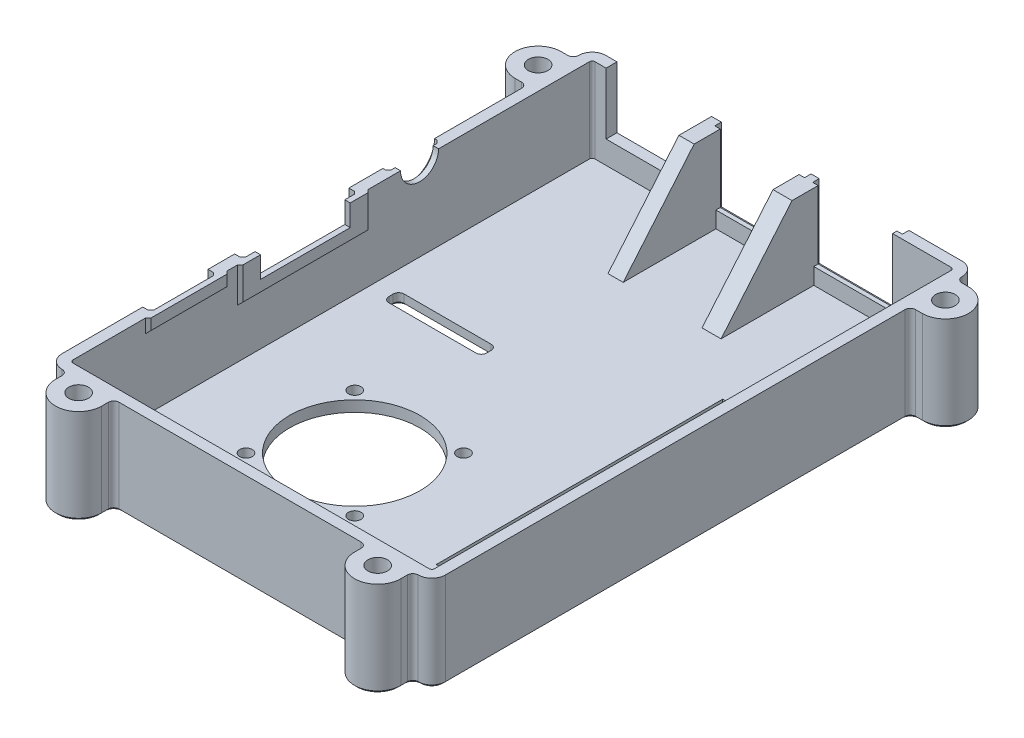
from build123d import *

# Parameters (mm, degrees)
BASE_DEPTH                      = 17.5
SHELL_T                         = -2
CLAMPS_DEPTH                    = 17.5
CLAMP_FILLETS_R                 = 1
SKETCH20_R                      = 1.8
CLAMP_HOLES_DEPTH               = 128.387411073
SKETCH21_R                      = 2.9
CLAMP_COUNTERSINKS_DEPTH        = 3.4
CLAMP_COUNTERSINK_CHAMFERS_SIZE = 0.3
SKETCH24_W                      = 14.5
SKETCH24_H                      = 12.5
USB_CUTOUT_DEPTH                = 18.25
SKETCH25_W                      = 16.5
SKETCH25_H                      = 13.5
USB_APPROACH_DEPTH              = 1.2
USB_INNER_SUPPORT_DEPTH         = 3.5
USB_OUTER_SUPPORT_DEPTH         = 2.8
SKETCH28_W                      = 17.4
SKETCH28_H                      = 11.3
RJ45_CUTOUT_DEPTH               = 22.7
SKETCH29_W                      = 15
SKETCH29_H                      = 2.5
SKETCH29_W_2                    = 24
SKETCH29_H_2                    = 6.43
HDMI_SUPPORT_DEPTH              = 0.5
HDMI_SUPPORT_CHAMFER_SIZE       = 0.5
SKETCH30_W                      = 21
SKETCH30_H                      = 5.93
SKETCH30_W_2                    = 12
SKETCH30_H_2                    = 2
HDMI_APPROACH_DEPTH             = 1.5
SKETCH31_W                      = 16.5
SKETCH31_H                      = 3.93
HDMI_CUTOUT_DEPTH               = 1
HDMI_APPROACH_CHAMFER_SIZE      = 0.5
SKETCH32_R                      = 3.5
AUDIO_CUTOUT_DEPTH              = 2
SKETCH33_R                      = 4.75
AUDIO_APPROACH_DEPTH            = 1
AUDIO_APPROACH_CHAMFER_SIZE     = 0.5
SKETCH34_W                      = 6
SKETCH34_H                      = 52.7
HEADER_CUTOUT_DEPTH             = 2
HEADER_COVER_DEPTH              = 1
SHELL_CHAMFER_SIZE              = 0.5
RIBBON_SLOT_DEPTH               = 2
RIBBON_SLOT_CHAMFER_SIZE        = 0.5
SKETCH39_R                      = 12
SKETCH39_R_2                    = 1.15
FAN_MOUNT_DEPTH                 = 2


with BuildPart() as part:
    # Sketch2 → Base (new body)
    with BuildSketch(Plane(origin=(0, 0, 0), x_dir=(1, 0, 0), z_dir=(0, 1, 0))):
        with BuildLine():
            Line((2.5, 0), (68, 0))
            ThreePointArc((68, 0), (69.767766953, 0.732233047), (70.5, 2.5))
            Line((70.5, 2.5), (70.5, 97.5))
            ThreePointArc((70.5, 97.5), (69.767766953, 99.267766953), (68, 100))
            Line((68, 100), (2.5, 100))
            ThreePointArc((2.5, 100), (0.732233047, 99.267766953), (0, 97.5))
            Line((0, 97.5), (0, 2.5))
            ThreePointArc((0, 2.5), (0.732233047, 0.732233047), (2.5, 0))
        make_face()
    extrude(amount=BASE_DEPTH)

    # Shell
    shell_openings = [part.faces().sort_by_distance(p)[0] for p in [
        (35.25, 17.5, -50),
    ]]
    offset(amount=SHELL_T, openings=shell_openings, kind=Kind.INTERSECTION)

    # Sketch14 → Clamps (add)
    with BuildSketch(Plane.XZ):
        with BuildLine():
            Line((-2.2, -88), (0, -88))
            Line((0, -88), (0, -96.5))
            Line((0, -96.5), (-2.2, -96.5))
            ThreePointArc((-2.2, -96.5), (-6.45, -92.25), (-2.2, -88))
        make_face()
        with BuildLine():
            Line((3.5, 2.2), (3.5, 0))
            Line((3.5, 0), (12, 0))
            Line((12, 0), (12, 2.2))
            ThreePointArc((12, 2.2), (7.75, 6.45), (3.5, 2.2))
        make_face()
        with BuildLine():
            Line((72.7, -88), (70.5, -88))
            Line((70.5, -88), (70.5, -96.5))
            Line((70.5, -96.5), (72.7, -96.5))
            ThreePointArc((72.7, -96.5), (76.95, -92.25), (72.7, -88))
        make_face()
        with BuildLine():
            Line((58.5, 0), (58.5, 2.2))
            ThreePointArc((58.5, 2.2), (62.75, 6.45), (67, 2.2))
            Line((67, 2.2), (67, 0))
            Line((67, 0), (58.5, 0))
        make_face()
    extrude(amount=-CLAMPS_DEPTH)

    # Clamp Fillets
    clamp_fillets_edges = [part.edges().sort_by_distance(p)[0] for p in [
        (0, 8.75, -96.5),
        (0, 8.75, -88),
        (3.5, 8.75, 0),
        (12, 8.75, 0),
        (70.5, 8.75, -88),
        (70.5, 8.75, -96.5),
        (58.5, 8.75, 0),
        (67, 8.75, 0),
    ]]
    fillet(clamp_fillets_edges, radius=CLAMP_FILLETS_R - 0.0001)  # a hair under: the kernel refuses the full size

    # Sketch20 → Clamp Holes (cut, through all)
    with BuildSketch(Plane.XZ):
        with Locations(Location((7.75, 2.2, 0), (0, 0, 270))):
            Circle(SKETCH20_R)
        with Locations(Location((62.75, 2.2, 0), (0, 0, 270))):
            Circle(SKETCH20_R)
        with Locations(Location((72.7, -92.25, 0), (0, 0, 270))):
            Circle(SKETCH20_R)
        with Locations(Location((-2.2, -92.25, 0), (0, 0, 270))):
            Circle(SKETCH20_R)
    extrude(amount=-CLAMP_HOLES_DEPTH, mode=Mode.SUBTRACT)

    # Sketch21 → Clamp Countersinks (cut)
    with BuildSketch(Plane.XZ):
        with Locations(Location((7.75, 2.2, 0), (0, 0, 270))):
            Circle(SKETCH21_R)
        with Locations(Location((62.75, 2.2, 0), (0, 0, 270))):
            Circle(SKETCH21_R)
        with Locations(Location((72.7, -92.25, 0), (0, 0, 270))):
            Circle(SKETCH21_R)
        with Locations(Location((-2.2, -92.25, 0), (0, 0, 270))):
            Circle(SKETCH21_R)
    extrude(amount=-CLAMP_COUNTERSINKS_DEPTH, mode=Mode.SUBTRACT)

    # Clamp Countersink Chamfers
    clamp_countersink_chamfers_edges = [part.edges().sort_by_distance(p)[0] for p in [
        (-2.2, 0, -89.35),
        (72.7, 0, -89.35),
        (62.75, 0, 5.1),
        (7.75, 0, 5.1),
    ]]
    chamfer(clamp_countersink_chamfers_edges, length=CLAMP_COUNTERSINK_CHAMFERS_SIZE)

    # Sketch24 → USB Cutout (cut)
    with BuildSketch(Plane(origin=(0, 0, -100), x_dir=(-1, 0, 0), z_dir=(0, 0, -1))):
        with Locations((-50, 11.25)):
            Rectangle(SKETCH24_W, SKETCH24_H)
        with Locations((-32, 11.25)):
            Rectangle(SKETCH24_W, SKETCH24_H)
    extrude(amount=-USB_CUTOUT_DEPTH, mode=Mode.SUBTRACT)

    # Sketch25 → USB Approach (cut)
    with BuildSketch(Plane(origin=(0, 0, -100), x_dir=(-1, 0, 0), z_dir=(0, 0, -1))):
        with Locations((-50, 10.75)):
            Rectangle(SKETCH25_W, SKETCH25_H)
        with Locations((-32, 10.75)):
            Rectangle(SKETCH25_W, SKETCH25_H)
    extrude(amount=-USB_APPROACH_DEPTH, mode=Mode.SUBTRACT)

    # Sketch26 → USB Inner Support (add)
    with BuildSketch(Plane(origin=(42.75, 0, 0), x_dir=(0, 0, -1), z_dir=(1, 0, 0))):
        Polygon((98, 2), (98, 17.5), (94, 17.5), (80.95, 2), align=None)
    extrude(amount=-USB_INNER_SUPPORT_DEPTH)

    # Sketch27 → USB Outer Support (add)
    with BuildSketch(Plane(origin=(24.75, 0, 0), x_dir=(0, 0, -1), z_dir=(1, 0, 0))):
        Polygon((98, 2), (98, 17.5), (94, 17.5), (80.95, 2), align=None)
    extrude(amount=-USB_OUTER_SUPPORT_DEPTH)

    # Sketch28 → RJ45 Cutout (cut)
    with BuildSketch(Plane(origin=(0, 0, -100), x_dir=(-1, 0, 0), z_dir=(0, 0, -1))):
        with Locations((-13.25, 11.85)):
            Rectangle(SKETCH28_W, SKETCH28_H)
    extrude(amount=-RJ45_CUTOUT_DEPTH, mode=Mode.SUBTRACT)

    # Sketch29 → HDMI Support (add)
    with BuildSketch(Plane(origin=(2, 0, 0), x_dir=(0, 0, -1), z_dir=(1, 0, 0))):
        with Locations((23.35, 16.25)):
            Rectangle(SKETCH29_W, SKETCH29_H)
        with Locations((44.75, 14.285)):
            Rectangle(SKETCH29_W_2, SKETCH29_H_2)
    extrude(amount=HDMI_SUPPORT_DEPTH)

    # HDMI Support Chamfer
    hdmi_support_chamfer_edges = [part.edges().sort_by_distance(p)[0] for p in [
        (2.5, 14.285, -56.75),
        (2.5, 11.07, -44.75),
        (2.5, 14.285, -32.75),
        (2.5, 16.25, -30.85),
        (2.5, 15, -23.35),
        (2.5, 16.25, -15.85),
    ]]
    chamfer(hdmi_support_chamfer_edges, length=HDMI_SUPPORT_CHAMFER_SIZE - 0.0001)  # a hair under: the kernel refuses the full size

    # Sketch30 → HDMI Approach (cut)
    with BuildSketch(Plane.ZY):
        with Locations((-44.75, 14.535)):
            Rectangle(SKETCH30_W, SKETCH30_H)
        with Locations((-23.35, 16.5)):
            Rectangle(SKETCH30_W_2, SKETCH30_H_2)
    extrude(amount=-HDMI_APPROACH_DEPTH, mode=Mode.SUBTRACT)

    # Sketch31 → HDMI Cutout (cut)
    with BuildSketch(Plane.ZY.offset(-1.5)):
        with Locations((-44.75, 15.535)):
            Rectangle(SKETCH31_W, SKETCH31_H)
    extrude(amount=-HDMI_CUTOUT_DEPTH, mode=Mode.SUBTRACT)

    # HDMI Approach Chamfer
    hdmi_approach_chamfer_edges = [part.edges().sort_by_distance(p)[0] for p in [
        (1.5, 14.535, -34.25),
        (1.5, 11.57, -44.75),
        (1.5, 14.535, -55.25),
        (1.5, 16.5, -29.35),
        (1.5, 16.5, -17.35),
        (1.5, 15.5, -23.35),
    ]]
    chamfer(hdmi_approach_chamfer_edges, length=HDMI_APPROACH_CHAMFER_SIZE)

    # Sketch32 → Audio Cutout (cut)
    with BuildSketch(Plane.ZY):
        with Locations((-66.25, 17.5)):
            Circle(SKETCH32_R)
    extrude(amount=-AUDIO_CUTOUT_DEPTH, mode=Mode.SUBTRACT)

    # Sketch33 → Audio Approach (cut)
    with BuildSketch(Plane.ZY):
        with Locations((-66.25, 17.5)):
            Circle(SKETCH33_R)
    extrude(amount=-AUDIO_APPROACH_DEPTH, mode=Mode.SUBTRACT)

    # Audio Approach Chamfer
    audio_approach_chamfer_edges = [part.edges().sort_by_distance(p)[0] for p in [
        (1, 12.75, -66.25),
    ]]
    chamfer(audio_approach_chamfer_edges, length=AUDIO_APPROACH_CHAMFER_SIZE)

    # Sketch34 → Header Cutout (cut)
    with BuildSketch(Plane.XZ):
        with Locations((55.5, -45.15)):
            Rectangle(SKETCH34_W, SKETCH34_H)
    extrude(amount=-HEADER_CUTOUT_DEPTH, mode=Mode.SUBTRACT)

    # Sketch35 → Header Cover (add)
    with BuildSketch(Plane.XZ):
        Polygon((56, -18.8), (55, -18.8), (55, -19.8), (53.5, -19.8), (53.5, -24.7625), (52.5, -24.7625), (52.5, -25.7625), (53.5, -25.7625), (53.5, -37.6875), (52.5, -37.6875), (52.5, -38.6875), (53.5, -38.6875), (53.5, -43.65), (55, -43.65), (55, -44.65), (52.5, -44.65), (52.5, -45.65), (55, -45.65), (55, -46.65), (53.5, -46.65), (53.5, -51.6125), (52.5, -51.6125), (52.5, -52.6125), (53.5, -52.6125), (53.5, -64.5375), (52.5, -64.5375), (52.5, -65.5375), (53.5, -65.5375), (53.5, -70.5), (55, -70.5), (55, -71.5), (56, -71.5), (56, -70.5), (57.5, -70.5), (57.5, -65.5375), (58.5, -65.5375), (58.5, -64.5375), (57.5, -64.5375), (57.5, -52.6125), (58.5, -52.6125), (58.5, -51.6125), (57.5, -51.6125), (57.5, -46.65), (56, -46.65), (56, -45.65), (58.5, -45.65), (58.5, -44.65), (56, -44.65), (56, -43.65), (57.5, -43.65), (57.5, -38.6875), (58.5, -38.6875), (58.5, -37.6875), (57.5, -37.6875), (57.5, -25.7625), (58.5, -25.7625), (58.5, -24.7625), (57.5, -24.7625), (57.5, -19.8), (56, -19.8), align=None)
    extrude(amount=-HEADER_COVER_DEPTH)

    # Shell Chamfer
    shell_chamfer_edges = [part.edges().sort_by_distance(p)[0] for p in [
        (-1.59995, 0, -88),
        (72.09995, 0, -96.5),
        (58.207136071, 0, 0.292863929),
        (0.732233047, 0, -0.732233047),
        (67.292863929, 0, 0.292863929),
        (12.292863929, 0, 0.292863929),
        (3.207136071, 0, 0.292863929),
        (-0.292863929, 0, -96.792863929),
        (-0.292863929, 0, -87.707136071),
        (70.792863929, 0, -87.707136071),
        (70.792863929, 0, -96.792863929),
        (-6.45, 0, -92.25),
        (-1.59995, 0, -96.5),
        (52.5, 0, -21.78125),
        (53.75, 0, -71.5),
        (58.5, 0, -68.51875),
        (57.25, 0, -18.8),
        (57.25, 0, -71.5),
        (58.5, 0, -58.575),
        (58.5, 0, -48.63125),
        (58.5, 0, -41.66875),
        (58.5, 0, -31.725),
        (58.5, 0, -21.78125),
        (53.75, 0, -18.8),
        (52.5, 0, -31.725),
        (52.5, 0, -41.66875),
        (52.5, 0, -48.63125),
        (52.5, 0, -58.575),
        (52.5, 0, -68.51875),
        (7.75, 0, 6.45),
        (3.5, 0, 1.59995),
        (76.95, 0, -92.25),
        (72.09995, 0, -88),
        (62.75, 0, 6.45),
        (58.5, 0, 1.59995),
        (0.732233047, 0, -99.267766953),
        (35.25, 0, -100),
        (69.767766953, 0, -99.267766953),
        (35.25, 0, 0),
        (70.5, 0, -44.75005),
        (67, 0, 1.59995),
        (12, 0, 1.59995),
        (69.767766953, 0, -0.732233047),
        (0, 0, -44.75005),
    ]]
    chamfer(shell_chamfer_edges, length=SHELL_CHAMFER_SIZE)

    # Sketch38 → Ribbon Slot (cut)
    with BuildSketch(Plane.XZ):
        with BuildLine():
            Line((6.45, -56.157), (22.45, -56.157))
            ThreePointArc((22.45, -56.157), (23.157106781, -56.449893219), (23.45, -57.157))
            Line((23.45, -57.157), (23.45, -57.957))
            ThreePointArc((23.45, -57.957), (23.157106781, -58.664106781), (22.45, -58.957))
            Line((22.45, -58.957), (6.45, -58.957))
            ThreePointArc((6.45, -58.957), (5.742893219, -58.664106781), (5.45, -57.957))
            Line((5.45, -57.957), (5.45, -57.157))
            ThreePointArc((5.45, -57.157), (5.742893219, -56.449893219), (6.45, -56.157))
        make_face()
    extrude(amount=-RIBBON_SLOT_DEPTH, mode=Mode.SUBTRACT)

    # Ribbon Slot Chamfer
    ribbon_slot_chamfer_edges = [part.edges().sort_by_distance(p)[0] for p in [
        (23.157106781, 0, -56.449893219),
        (14.45, 0, -56.157),
        (5.742893219, 0, -56.449893219),
        (5.45, 0, -57.557),
        (5.742893219, 0, -58.664106781),
        (14.45, 0, -58.957),
        (23.157106781, 0, -58.664106781),
        (23.45, 0, -57.557),
    ]]
    chamfer(ribbon_slot_chamfer_edges, length=RIBBON_SLOT_CHAMFER_SIZE)

    # Sketch39 → Fan Mount (cut)
    with BuildSketch(Plane.XZ):
        with Locations(Location((27.25, -29.0785, 0), (0, 0, 270))):
            Circle(SKETCH39_R)
        with Locations(Location((37.24997481, -19.07852519, 0), (0, 0, 270))):
            Circle(SKETCH39_R_2)
        with Locations(Location((37.24997481, -39.07847481, 0), (0, 0, 90))):
            Circle(SKETCH39_R_2)
        with Locations(Location((17.25002519, -39.07847481, 0), (0, 0, 270))):
            Circle(SKETCH39_R_2)
        with Locations(Location((17.25002519, -19.07852519, 0), (0, 0, 90))):
            Circle(SKETCH39_R_2)
    extrude(amount=-FAN_MOUNT_DEPTH, mode=Mode.SUBTRACT)


solid = part.part
